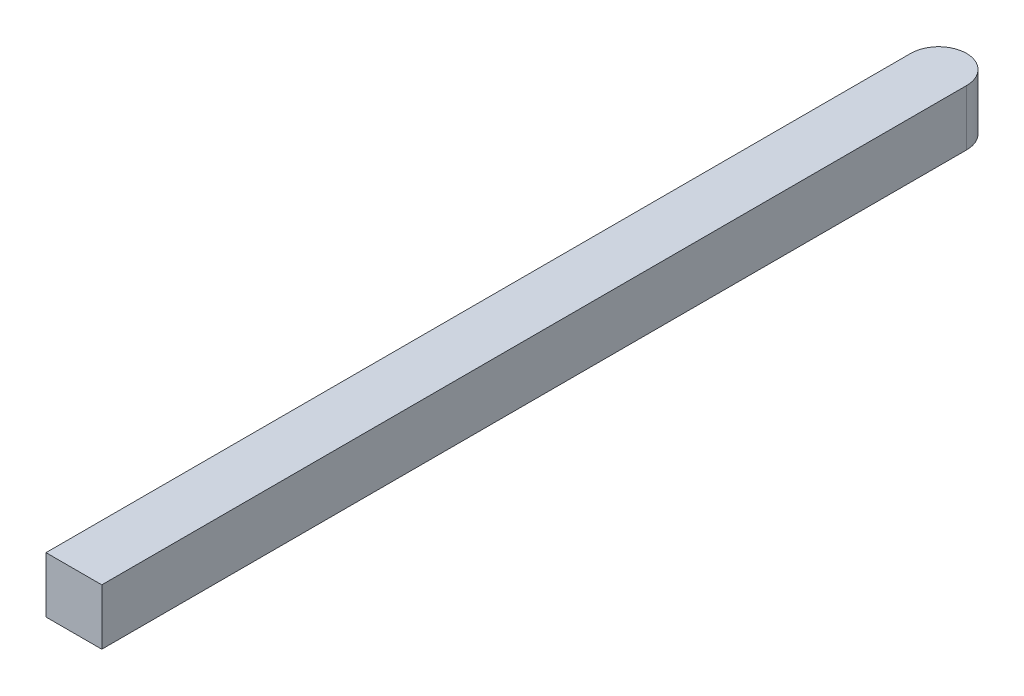
from build123d import *

# Parameters (mm, degrees)
SKETCH_1_W      = 50
SKETCH_1_H      = 800
EXTRUDE_1_DEPTH = 50
FILLET_1_R      = 25


with BuildPart() as part:
    # 草图1 → 凸台-拉伸1 (new body)
    with BuildSketch(Plane(origin=(0, 0, 0), x_dir=(1, 0, 0), z_dir=(0, 1, 0))):
        with Locations((25, 400)):
            Rectangle(SKETCH_1_W, SKETCH_1_H)
    extrude(amount=EXTRUDE_1_DEPTH)

    # 圆角1
    fillet_1_edges = [part.edges().sort_by_distance(p)[0] for p in [
        (0, 25, -800),
        (50, 25, -800),
    ]]
    fillet(fillet_1_edges, radius=FILLET_1_R - 0.0001)  # a hair under: the kernel refuses the full size


solid = part.part
